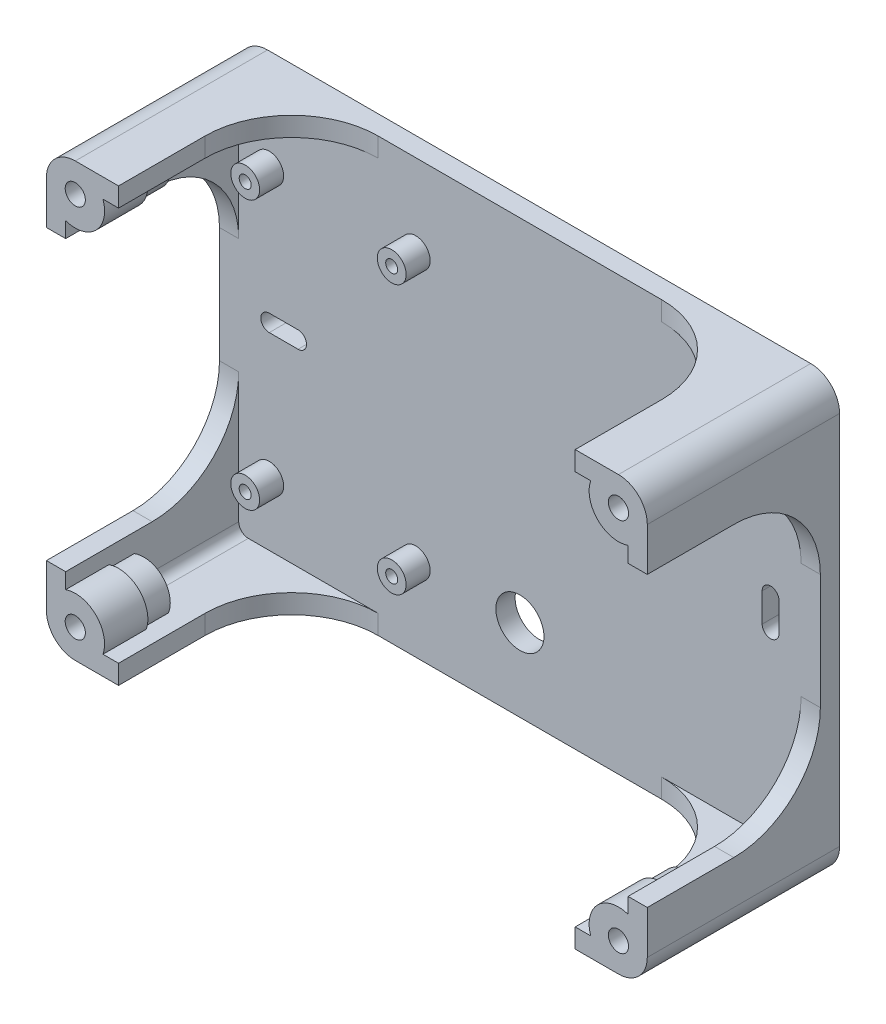
from build123d import *

# Parameters (mm, degrees)
SKETCH1_W                               = 125
SKETCH1_H                               = 90
BOSS_EXTRUDE1_DEPTH                     = 40
FILLET1_R                               = 6
CBORE_FOR_M5_HEX_HEAD_BOLT1_D           = 3
CBORE_FOR_M5_HEX_HEAD_BOLT1_DEPTH       = 12
CBORE_FOR_M5_HEX_HEAD_BOLT1_CBORE_D     = 4.2
CBORE_FOR_M5_HEX_HEAD_BOLT1_CBORE_DEPTH = 5
CBORE_FOR_M5_HEX_HEAD_BOLT1_TIP         = 0.901290929
SHELL2_START                            = 4
SHELL2_DEPTH                            = 36
SHELL2_2_DEPTH                          = 21.736908887
SHELL2_START_2                          = 23.633896721
SHELL2_3_DEPTH                          = 7.366103279
SKETCH11_W                              = 95
SKETCH11_H                              = 36
CUT_EXTRUDE4_DEPTH                      = 117.645831473
SKETCH12_W                              = 36
SKETCH12_H                              = 60
CUT_EXTRUDE5_DEPTH                      = 139.744369255
SKETCH7_R                               = 3
BOSS_EXTRUDE2_DEPTH                     = 5
M3X0_5_TAPPED_HOLE1_D                   = 2.5
M3X0_5_TAPPED_HOLE1_DEPTH               = 7.5
M3X0_5_TAPPED_HOLE1_TIP                 = 0.751075774
FILLET3_R                               = 18
FILLET4_R                               = 18
CUT_EXTRUDE1_DEPTH                      = 86.013234264
SKETCH7_5_R                             = 5
CUT_EXTRUDE2_DEPTH                      = 86.013234264
CUT_EXTRUDE3_DEPTH                      = 86.013234264


with BuildPart() as part:
    # Sketch1 → Boss-Extrude1 (new body)
    with BuildSketch(Plane.XY):
        Rectangle(SKETCH1_W, SKETCH1_H)
    extrude(amount=BOSS_EXTRUDE1_DEPTH)

    # Fillet1
    fillet1_edges = [part.edges().sort_by_distance(p)[0] for p in [
        (62.5, -45, 20),
        (-62.5, -45, 20),
        (-62.5, 45, 20),
        (62.5, 45, 20),
    ]]
    fillet(fillet1_edges, radius=FILLET1_R)

    # CBORE for M5 Hex Head Bolt1
    with Locations(Plane.XY.offset(40)):
        with Locations((-56.5, 39), (56.5, 39), (56.5, -39), (-56.5, -39)):
            CounterBoreHole(CBORE_FOR_M5_HEX_HEAD_BOLT1_D / 2, CBORE_FOR_M5_HEX_HEAD_BOLT1_CBORE_D / 2, CBORE_FOR_M5_HEX_HEAD_BOLT1_CBORE_DEPTH, depth=CBORE_FOR_M5_HEX_HEAD_BOLT1_DEPTH)
            with Locations((0, 0, -(CBORE_FOR_M5_HEX_HEAD_BOLT1_DEPTH + CBORE_FOR_M5_HEX_HEAD_BOLT1_TIP / 2))):  # 118° drill point
                Cone(0, CBORE_FOR_M5_HEX_HEAD_BOLT1_D / 2, CBORE_FOR_M5_HEX_HEAD_BOLT1_TIP, mode=Mode.SUBTRACT)

    # Shell2: read off the stored shape, not the designer's step
    # Shell2 outline → Shell2 (cut)
    with BuildSketch(Plane.XY.offset(SHELL2_START)):
        with BuildLine():
            ThreePointArc((58.5, 33.237188186), (52.186648635, 34.686648635), (50.737188186, 41))
            Line((50.737188186, 41), (-50.737188186, 41))
            ThreePointArc((-50.737188186, 41), (-52.186648635, 34.686648635), (-58.5, 33.237188186))
            Line((-58.5, 33.237188186), (-58.5, -33.237188186))
            ThreePointArc((-58.5, -33.237188186), (-52.186648635, -34.686648635), (-50.737188186, -41))
            Line((-50.737188186, -41), (50.737188186, -41))
            ThreePointArc((50.737188186, -41), (52.186648635, -34.686648635), (58.5, -33.237188186))
            Line((58.5, -33.237188186), (58.5, 33.237188186))
        make_face()
    extrude(amount=SHELL2_DEPTH, mode=Mode.SUBTRACT)

    # Shell2 2 outline → Shell2 2 (cut)
    with BuildSketch(Plane.XY.offset(SHELL2_START)):
        with BuildLine():
            Line((56.5, 41), (50.737188186, 41))
            ThreePointArc((50.737188186, 41), (52.186648635, 34.686648635), (58.5, 33.237188186))
            Line((58.5, 33.237188186), (58.5, 39))
            ThreePointArc((58.5, 39), (57.914213562, 40.414213562), (56.5, 41))
        make_face()
        with BuildLine():
            ThreePointArc((-58.5, 33.237188186), (-52.186648635, 34.686648635), (-50.737188186, 41))
            Line((-50.737188186, 41), (-56.5, 41))
            ThreePointArc((-56.5, 41), (-57.914213562, 40.414213562), (-58.5, 39))
            Line((-58.5, 39), (-58.5, 33.237188186))
        make_face()
        with BuildLine():
            ThreePointArc((58.5, -33.237188186), (52.186648635, -34.686648635), (50.737188186, -41))
            Line((50.737188186, -41), (56.5, -41))
            ThreePointArc((56.5, -41), (57.914213562, -40.414213562), (58.5, -39))
            Line((58.5, -39), (58.5, -33.237188186))
        make_face()
        with BuildLine():
            ThreePointArc((-50.737188186, -41), (-52.186648635, -34.686648635), (-58.5, -33.237188186))
            Line((-58.5, -33.237188186), (-58.5, -39))
            ThreePointArc((-58.5, -39), (-57.914213562, -40.414213562), (-56.5, -41))
            Line((-56.5, -41), (-50.737188186, -41))
        make_face()
    extrude(amount=SHELL2_2_DEPTH, mode=Mode.SUBTRACT)

    # Shell2 3 outline → Shell2 3 (cut)
    with BuildSketch(Plane.XY.offset(SHELL2_START_2)):
        with BuildLine():
            ThreePointArc((58.5, 33.876524617), (52.610912703, 35.110912703), (51.376524617, 41))
            Line((51.376524617, 41), (50.737188186, 41))
            ThreePointArc((50.737188186, 41), (52.186648635, 34.686648635), (58.5, 33.237188186))
            Line((58.5, 33.237188186), (58.5, 33.876524617))
        make_face()
        with BuildLine():
            ThreePointArc((-58.5, 33.237188186), (-52.186648635, 34.686648635), (-50.737188186, 41))
            Line((-50.737188186, 41), (-51.376524617, 41))
            ThreePointArc((-51.376524617, 41), (-52.610912703, 35.110912703), (-58.5, 33.876524617))
            Line((-58.5, 33.876524617), (-58.5, 33.237188186))
        make_face()
        with BuildLine():
            Line((58.5, -33.876524617), (58.5, -33.237188186))
            ThreePointArc((58.5, -33.237188186), (52.186648635, -34.686648635), (50.737188186, -41))
            Line((50.737188186, -41), (51.376524617, -41))
            ThreePointArc((51.376524617, -41), (52.610912703, -35.110912703), (58.5, -33.876524617))
        make_face()
        with BuildLine():
            ThreePointArc((-50.737188186, -41), (-52.186648635, -34.686648635), (-58.5, -33.237188186))
            Line((-58.5, -33.237188186), (-58.5, -33.876524617))
            ThreePointArc((-58.5, -33.876524617), (-52.610912703, -35.110912703), (-51.376524617, -41))
            Line((-51.376524617, -41), (-50.737188186, -41))
        make_face()
    extrude(amount=SHELL2_3_DEPTH, mode=Mode.SUBTRACT)

    # Shell2 4 outline → Shell2 4 (revolve)
    with BuildSketch(Plane(origin=(56.5, 39, 0), x_dir=(1, 0, 0), z_dir=(0, -1, 0))):
        Polygon((0, 25.736908889), (0, 22.432175483), (5.500000002, 25.736908889), align=None)
    revolve(axis=Axis((56.5, 39, 0), (0, 0, 1)))

    # Shell2 5 outline → Shell2 5 (revolve)
    with BuildSketch(Plane(origin=(56.5, -39, 0), x_dir=(1, 0, 0), z_dir=(0, -1, 0))):
        Polygon((0, 25.736908889), (0, 22.432175483), (5.500000002, 25.736908889), align=None)
    revolve(axis=Axis((56.5, -39, 0), (0, 0, 1)))

    # Shell2 6 outline → Shell2 6 (revolve)
    with BuildSketch(Plane(origin=(-56.5, 39, 0), x_dir=(1, 0, 0), z_dir=(0, -1, 0))):
        Polygon((0, 25.736908889), (0, 22.432175483), (5.500000002, 25.736908889), align=None)
    revolve(axis=Axis((-56.5, 39, 0), (0, 0, 1)))

    # Shell2 7 outline → Shell2 7 (revolve)
    with BuildSketch(Plane(origin=(-56.5, -39, 0), x_dir=(1, 0, 0), z_dir=(0, -1, 0))):
        Polygon((0, 25.736908887), (0, 22.432175483), (5.5, 25.736908887), align=None)
    revolve(axis=Axis((-56.5, -39, 0), (0, 0, 1)))

    # Sketch11 → Cut-Extrude4 (cut, through all)
    with BuildSketch(Plane.XZ.offset(45)):
        with Locations((0, 22)):
            Rectangle(SKETCH11_W, SKETCH11_H)
    extrude(amount=-CUT_EXTRUDE4_DEPTH, mode=Mode.SUBTRACT)

    # Sketch12 → Cut-Extrude5 (cut, through all)
    with BuildSketch(Plane(origin=(62.5, 0, 0), x_dir=(0, 0, -1), z_dir=(1, 0, 0))):
        with Locations((-22, 0)):
            Rectangle(SKETCH12_W, SKETCH12_H)
    extrude(amount=-CUT_EXTRUDE5_DEPTH, mode=Mode.SUBTRACT)

    # Sketch7 → Boss-Extrude2 (add)
    with BuildSketch(Plane.XY.offset(4)):
        with Locations((-52.15, 27.94)):
            Circle(SKETCH7_R)
        with Locations((-21.67, 27.94)):
            Circle(SKETCH7_R)
        with Locations((-52.15, -27.94)):
            Circle(SKETCH7_R)
        with Locations((-21.67, -27.94)):
            Circle(SKETCH7_R)
    extrude(amount=BOSS_EXTRUDE2_DEPTH)

    # M3x0.5 Tapped Hole1
    with Locations(Plane.XY.offset(9)):
        with Locations((-52.15, 27.94), (-21.67, 27.94), (-21.67, -27.94), (-52.15, -27.94)):
            Hole(M3X0_5_TAPPED_HOLE1_D / 2, depth=M3X0_5_TAPPED_HOLE1_DEPTH)
            with Locations((0, 0, -(M3X0_5_TAPPED_HOLE1_DEPTH + M3X0_5_TAPPED_HOLE1_TIP / 2))):  # 118° drill point
                Cone(0, M3X0_5_TAPPED_HOLE1_D / 2, M3X0_5_TAPPED_HOLE1_TIP, mode=Mode.SUBTRACT)

    # Fillet3
    fillet3_edges = [part.edges().sort_by_distance(p)[0] for p in [
        (47.5, 43, 4),
        (-47.5, 43, 4),
        (47.5, -43, 4),
        (-47.5, -43, 4),
    ]]
    fillet(fillet3_edges, radius=FILLET3_R)

    # Fillet4
    fillet4_edges = [part.edges().sort_by_distance(p)[0] for p in [
        (60.5, 30, 4),
        (60.5, -30, 4),
        (-60.5, 30, 4),
        (-60.5, -30, 4),
    ]]
    fillet(fillet4_edges, radius=FILLET4_R)

    # Sketch7<4> → Cut-Extrude1 (cut, through all)
    with BuildSketch(Plane.XY.offset(4)):
        with BuildLine():
            Line((-52.15, 1.75), (-46.15, 1.75))
            ThreePointArc((-46.15, 1.75), (-44.4, 0), (-46.15, -1.75))
            Line((-46.15, -1.75), (-52.15, -1.75))
            ThreePointArc((-52.15, -1.75), (-53.9, 0), (-52.15, 1.75))
        make_face()
    extrude(amount=-CUT_EXTRUDE1_DEPTH, mode=Mode.SUBTRACT)

    # Sketch7<5> → Cut-Extrude2 (cut, through all)
    with BuildSketch(Plane.XY.offset(4)):
        with Locations((0, -27.94)):
            Circle(SKETCH7_5_R)
    extrude(amount=-CUT_EXTRUDE2_DEPTH, mode=Mode.SUBTRACT)

    # Sketch7<6> → Cut-Extrude3 (cut, through all)
    with BuildSketch(Plane.XY.offset(4)):
        with BuildLine():
            Line((53.9, 3), (53.9, -3))
            ThreePointArc((53.9, -3), (52.15, -4.75), (50.4, -3))
            Line((50.4, -3), (50.4, 3))
            ThreePointArc((50.4, 3), (52.15, 4.75), (53.9, 3))
        make_face()
    extrude(amount=-CUT_EXTRUDE3_DEPTH, mode=Mode.SUBTRACT)


solid = part.part
